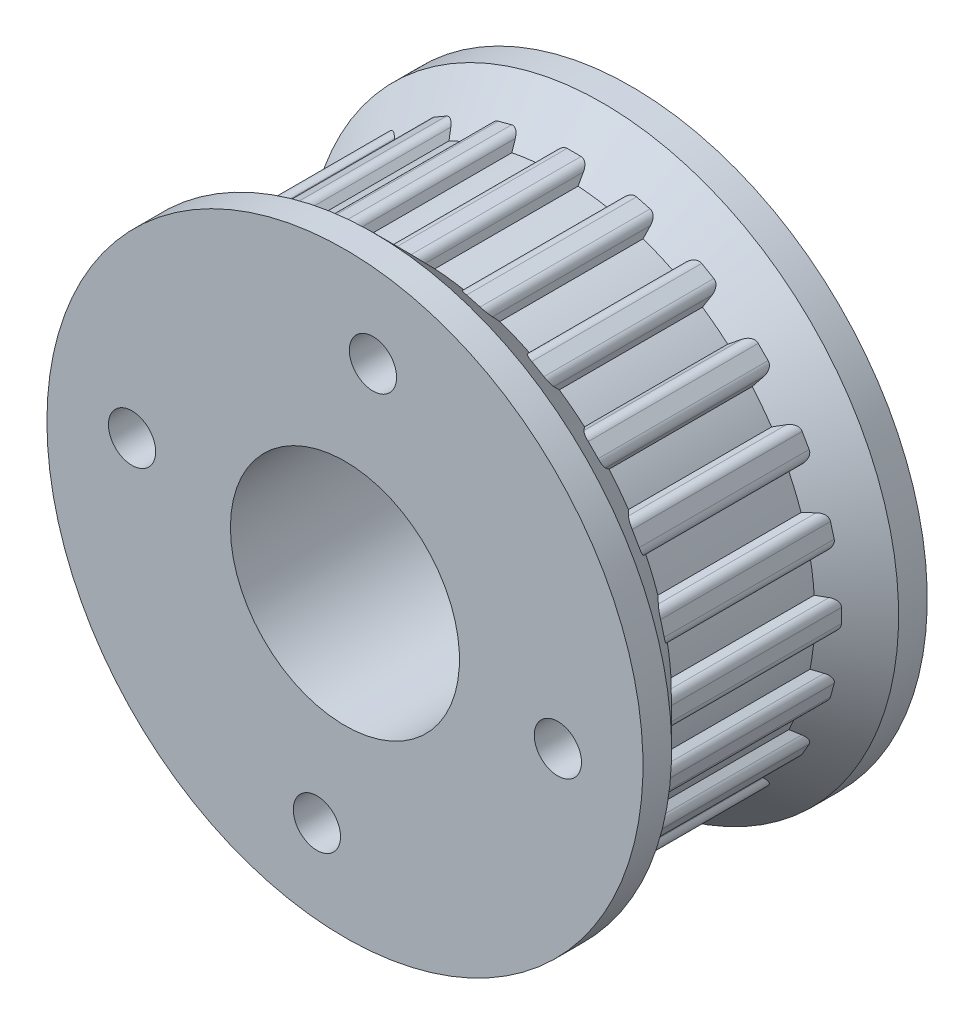
from build123d import *

# Parameters (mm, degrees)
ESQUISSE1_R             = 8
BOSS_EXTRU_1_DEPTH      = 19
ESQUISSE2_R             = 1.65
ENL_V_MAT_EXTRU_1_DEPTH = 36.592423812


with BuildPart() as part:
    # Esquisse1 → Boss.-Extru.1 (new body)
    with BuildSketch(Plane.XY):
        with BuildLine():
            Line((0.488939824, 18.675887158), (0, 18.675887158))
            Line((0, 18.675887158), (-0.488939824, 18.675887158))
            ThreePointArc((-0.488939824, 18.675887158), (-0.854196682, 18.551899162), (-1.06849532, 18.231178585))
            Line((-1.06849532, 18.231178585), (-1.352750131, 17.170325189))
            Line((-1.352750131, 17.170325189), (-3.137350881, 16.935378043))
            Line((-3.137350881, 16.935378043), (-3.686489007, 17.886513177))
            ThreePointArc((-3.686489007, 17.886513177), (-3.97649419, 18.140840897), (-4.361395677, 18.166068673))
            Line((-4.361395677, 18.166068673), (-4.833675281, 18.039521734))
            Line((-4.833675281, 18.039521734), (-5.305954884, 17.912974796))
            ThreePointArc((-5.305954884, 17.912974796), (-5.626675462, 17.698676158), (-5.750663457, 17.3334193))
            Line((-5.750663457, 17.3334193), (-5.750663457, 16.235143048))
            Line((-5.750663457, 16.235143048), (-7.413646616, 15.54631287))
            Line((-7.413646616, 15.54631287), (-8.190245201, 16.322911455))
            ThreePointArc((-8.190245201, 16.322911455), (-8.536193555, 16.493514304), (-8.91450927, 16.418262629))
            Line((-8.91450927, 16.418262629), (-9.337943579, 16.173792717))
            Line((-9.337943579, 16.173792717), (-9.761377888, 15.929322805))
            ThreePointArc((-9.761377888, 15.929322805), (-10.015705607, 15.639317622), (-10.040933383, 15.254416135))
            Line((-10.040933383, 15.254416135), (-9.756678573, 14.193562739))
            Line((-9.756678573, 14.193562739), (-11.184714585, 13.097792167))
            Line((-11.184714585, 13.097792167), (-12.13584972, 13.646930293))
            ThreePointArc((-12.13584972, 13.646930293), (-12.514165435, 13.722181967), (-12.860113788, 13.551579119))
            Line((-12.860113788, 13.551579119), (-13.205846454, 13.205846454))
            Line((-13.205846454, 13.205846454), (-13.551579119, 12.860113788))
            ThreePointArc((-13.551579119, 12.860113788), (-13.722181967, 12.514165435), (-13.646930293, 12.13584972))
            Line((-13.646930293, 12.13584972), (-13.097792167, 11.184714585))
            Line((-13.097792167, 11.184714585), (-14.193562739, 9.756678573))
            Line((-14.193562739, 9.756678573), (-15.254416135, 10.040933383))
            ThreePointArc((-15.254416135, 10.040933383), (-15.639317622, 10.015705607), (-15.929322805, 9.761377888))
            Line((-15.929322805, 9.761377888), (-16.173792717, 9.337943579))
            Line((-16.173792717, 9.337943579), (-16.418262629, 8.91450927))
            ThreePointArc((-16.418262629, 8.91450927), (-16.493514304, 8.536193555), (-16.322911455, 8.190245201))
            Line((-16.322911455, 8.190245201), (-15.54631287, 7.413646616))
            Line((-15.54631287, 7.413646616), (-16.235143048, 5.750663457))
            Line((-16.235143048, 5.750663457), (-17.3334193, 5.750663457))
            ThreePointArc((-17.3334193, 5.750663457), (-17.698676158, 5.626675462), (-17.912974796, 5.305954884))
            Line((-17.912974796, 5.305954884), (-18.039521734, 4.833675281))
            Line((-18.039521734, 4.833675281), (-18.166068673, 4.361395677))
            ThreePointArc((-18.166068673, 4.361395677), (-18.140840897, 3.97649419), (-17.886513177, 3.686489007))
            Line((-17.886513177, 3.686489007), (-16.935378043, 3.137350881))
            Line((-16.935378043, 3.137350881), (-17.170325189, 1.352750131))
            Line((-17.170325189, 1.352750131), (-18.231178585, 1.06849532))
            ThreePointArc((-18.231178585, 1.06849532), (-18.551899162, 0.854196682), (-18.675887158, 0.488939824))
            Line((-18.675887158, 0.488939824), (-18.675887158, 0))
            Line((-18.675887158, 0), (-18.675887158, -0.488939824))
            ThreePointArc((-18.675887158, -0.488939824), (-18.551899162, -0.854196682), (-18.231178585, -1.06849532))
            Line((-18.231178585, -1.06849532), (-17.170325189, -1.352750131))
            Line((-17.170325189, -1.352750131), (-16.935378043, -3.137350881))
            Line((-16.935378043, -3.137350881), (-17.886513177, -3.686489007))
            ThreePointArc((-17.886513177, -3.686489007), (-18.140840897, -3.97649419), (-18.166068673, -4.361395677))
            Line((-18.166068673, -4.361395677), (-18.039521734, -4.833675281))
            Line((-18.039521734, -4.833675281), (-17.912974796, -5.305954884))
            ThreePointArc((-17.912974796, -5.305954884), (-17.698676158, -5.626675462), (-17.3334193, -5.750663457))
            Line((-17.3334193, -5.750663457), (-16.235143048, -5.750663457))
            Line((-16.235143048, -5.750663457), (-15.54631287, -7.413646616))
            Line((-15.54631287, -7.413646616), (-16.322911455, -8.190245201))
            ThreePointArc((-16.322911455, -8.190245201), (-16.493514304, -8.536193555), (-16.418262629, -8.91450927))
            Line((-16.418262629, -8.91450927), (-16.173792717, -9.337943579))
            Line((-16.173792717, -9.337943579), (-15.929322805, -9.761377888))
            ThreePointArc((-15.929322805, -9.761377888), (-15.639317622, -10.015705607), (-15.254416135, -10.040933383))
            Line((-15.254416135, -10.040933383), (-14.193562739, -9.756678573))
            Line((-14.193562739, -9.756678573), (-13.097792167, -11.184714585))
            Line((-13.097792167, -11.184714585), (-13.646930293, -12.13584972))
            ThreePointArc((-13.646930293, -12.13584972), (-13.722181967, -12.514165435), (-13.551579119, -12.860113788))
            Line((-13.551579119, -12.860113788), (-13.205846454, -13.205846454))
            Line((-13.205846454, -13.205846454), (-12.860113788, -13.551579119))
            ThreePointArc((-12.860113788, -13.551579119), (-12.514165435, -13.722181967), (-12.13584972, -13.646930293))
            Line((-12.13584972, -13.646930293), (-11.184714585, -13.097792167))
            Line((-11.184714585, -13.097792167), (-9.756678573, -14.193562739))
            Line((-9.756678573, -14.193562739), (-10.040933383, -15.254416135))
            ThreePointArc((-10.040933383, -15.254416135), (-10.015705607, -15.639317622), (-9.761377888, -15.929322805))
            Line((-9.761377888, -15.929322805), (-9.337943579, -16.173792717))
            Line((-9.337943579, -16.173792717), (-8.91450927, -16.418262629))
            ThreePointArc((-8.91450927, -16.418262629), (-8.536193555, -16.493514304), (-8.190245201, -16.322911455))
            Line((-8.190245201, -16.322911455), (-7.413646616, -15.54631287))
            Line((-7.413646616, -15.54631287), (-5.750663457, -16.235143048))
            Line((-5.750663457, -16.235143048), (-5.750663457, -17.3334193))
            ThreePointArc((-5.750663457, -17.3334193), (-5.626675462, -17.698676158), (-5.305954884, -17.912974796))
            Line((-5.305954884, -17.912974796), (-4.833675281, -18.039521734))
            Line((-4.833675281, -18.039521734), (-4.361395677, -18.166068673))
            ThreePointArc((-4.361395677, -18.166068673), (-3.97649419, -18.140840897), (-3.686489007, -17.886513177))
            Line((-3.686489007, -17.886513177), (-3.137350881, -16.935378043))
            Line((-3.137350881, -16.935378043), (-1.352750131, -17.170325189))
            Line((-1.352750131, -17.170325189), (-1.06849532, -18.231178585))
            ThreePointArc((-1.06849532, -18.231178585), (-0.854196682, -18.551899162), (-0.488939824, -18.675887158))
            Line((-0.488939824, -18.675887158), (0, -18.675887158))
            Line((0, -18.675887158), (0.488939824, -18.675887158))
            ThreePointArc((0.488939824, -18.675887158), (0.854196682, -18.551899162), (1.06849532, -18.231178585))
            Line((1.06849532, -18.231178585), (1.352750131, -17.170325189))
            Line((1.352750131, -17.170325189), (3.137350881, -16.935378043))
            Line((3.137350881, -16.935378043), (3.686489007, -17.886513177))
            ThreePointArc((3.686489007, -17.886513177), (3.97649419, -18.140840897), (4.361395677, -18.166068673))
            Line((4.361395677, -18.166068673), (4.833675281, -18.039521734))
            Line((4.833675281, -18.039521734), (5.305954884, -17.912974796))
            ThreePointArc((5.305954884, -17.912974796), (5.626675462, -17.698676158), (5.750663457, -17.3334193))
            Line((5.750663457, -17.3334193), (5.750663457, -16.235143048))
            Line((5.750663457, -16.235143048), (7.413646616, -15.54631287))
            Line((7.413646616, -15.54631287), (8.190245201, -16.322911455))
            ThreePointArc((8.190245201, -16.322911455), (8.536193555, -16.493514304), (8.91450927, -16.418262629))
            Line((8.91450927, -16.418262629), (9.337943579, -16.173792717))
            Line((9.337943579, -16.173792717), (9.761377888, -15.929322805))
            ThreePointArc((9.761377888, -15.929322805), (10.015705607, -15.639317622), (10.040933383, -15.254416135))
            Line((10.040933383, -15.254416135), (9.756678573, -14.193562739))
            Line((9.756678573, -14.193562739), (11.184714585, -13.097792167))
            Line((11.184714585, -13.097792167), (12.13584972, -13.646930293))
            ThreePointArc((12.13584972, -13.646930293), (12.514165435, -13.722181967), (12.860113788, -13.551579119))
            Line((12.860113788, -13.551579119), (13.205846454, -13.205846454))
            Line((13.205846454, -13.205846454), (13.551579119, -12.860113788))
            ThreePointArc((13.551579119, -12.860113788), (13.722181967, -12.514165435), (13.646930293, -12.13584972))
            Line((13.646930293, -12.13584972), (13.097792167, -11.184714585))
            Line((13.097792167, -11.184714585), (14.193562739, -9.756678573))
            Line((14.193562739, -9.756678573), (15.254416135, -10.040933383))
            ThreePointArc((15.254416135, -10.040933383), (15.639317622, -10.015705607), (15.929322805, -9.761377888))
            Line((15.929322805, -9.761377888), (16.173792717, -9.337943579))
            Line((16.173792717, -9.337943579), (16.418262629, -8.91450927))
            ThreePointArc((16.418262629, -8.91450927), (16.493514304, -8.536193555), (16.322911455, -8.190245201))
            Line((16.322911455, -8.190245201), (15.54631287, -7.413646616))
            Line((15.54631287, -7.413646616), (16.235143048, -5.750663457))
            Line((16.235143048, -5.750663457), (17.3334193, -5.750663457))
            ThreePointArc((17.3334193, -5.750663457), (17.698676158, -5.626675462), (17.912974796, -5.305954884))
            Line((17.912974796, -5.305954884), (18.039521734, -4.833675281))
            Line((18.039521734, -4.833675281), (18.166068673, -4.361395677))
            ThreePointArc((18.166068673, -4.361395677), (18.140840897, -3.97649419), (17.886513177, -3.686489007))
            Line((17.886513177, -3.686489007), (16.935378043, -3.137350881))
            Line((16.935378043, -3.137350881), (17.170325189, -1.352750131))
            Line((17.170325189, -1.352750131), (18.231178585, -1.06849532))
            ThreePointArc((18.231178585, -1.06849532), (18.551899162, -0.854196682), (18.675887158, -0.488939824))
            Line((18.675887158, -0.488939824), (18.675887158, 0))
            Line((18.675887158, 0), (18.675887158, 0.488939824))
            ThreePointArc((18.675887158, 0.488939824), (18.551899162, 0.854196682), (18.231178585, 1.06849532))
            Line((18.231178585, 1.06849532), (17.170325189, 1.352750131))
            Line((17.170325189, 1.352750131), (16.935378043, 3.137350881))
            Line((16.935378043, 3.137350881), (17.886513177, 3.686489007))
            ThreePointArc((17.886513177, 3.686489007), (18.140840897, 3.97649419), (18.166068673, 4.361395677))
            Line((18.166068673, 4.361395677), (18.039521734, 4.833675281))
            Line((18.039521734, 4.833675281), (17.912974796, 5.305954884))
            ThreePointArc((17.912974796, 5.305954884), (17.698676158, 5.626675462), (17.3334193, 5.750663457))
            Line((17.3334193, 5.750663457), (16.235143048, 5.750663457))
            Line((16.235143048, 5.750663457), (15.54631287, 7.413646616))
            Line((15.54631287, 7.413646616), (16.322911455, 8.190245201))
            ThreePointArc((16.322911455, 8.190245201), (16.493514304, 8.536193555), (16.418262629, 8.91450927))
            Line((16.418262629, 8.91450927), (16.173792717, 9.337943579))
            Line((16.173792717, 9.337943579), (15.929322805, 9.761377888))
            ThreePointArc((15.929322805, 9.761377888), (15.639317622, 10.015705607), (15.254416135, 10.040933383))
            Line((15.254416135, 10.040933383), (14.193562739, 9.756678573))
            Line((14.193562739, 9.756678573), (13.097792167, 11.184714585))
            Line((13.097792167, 11.184714585), (13.646930293, 12.13584972))
            ThreePointArc((13.646930293, 12.13584972), (13.722181967, 12.514165435), (13.551579119, 12.860113788))
            Line((13.551579119, 12.860113788), (13.205846454, 13.205846454))
            Line((13.205846454, 13.205846454), (12.860113788, 13.551579119))
            ThreePointArc((12.860113788, 13.551579119), (12.514165435, 13.722181967), (12.13584972, 13.646930293))
            Line((12.13584972, 13.646930293), (11.184714585, 13.097792167))
            Line((11.184714585, 13.097792167), (9.756678573, 14.193562739))
            Line((9.756678573, 14.193562739), (10.040933383, 15.254416135))
            ThreePointArc((10.040933383, 15.254416135), (10.015705607, 15.639317622), (9.761377888, 15.929322805))
            Line((9.761377888, 15.929322805), (9.337943579, 16.173792717))
            Line((9.337943579, 16.173792717), (8.91450927, 16.418262629))
            ThreePointArc((8.91450927, 16.418262629), (8.536193555, 16.493514304), (8.190245201, 16.322911455))
            Line((8.190245201, 16.322911455), (7.413646616, 15.54631287))
            Line((7.413646616, 15.54631287), (5.750663457, 16.235143048))
            Line((5.750663457, 16.235143048), (5.750663457, 17.3334193))
            ThreePointArc((5.750663457, 17.3334193), (5.626675462, 17.698676158), (5.305954884, 17.912974796))
            Line((5.305954884, 17.912974796), (4.833675281, 18.039521734))
            Line((4.833675281, 18.039521734), (4.361395677, 18.166068673))
            ThreePointArc((4.361395677, 18.166068673), (3.97649419, 18.140840897), (3.686489007, 17.886513177))
            Line((3.686489007, 17.886513177), (3.137350881, 16.935378043))
            Line((3.137350881, 16.935378043), (1.352750131, 17.170325189))
            Line((1.352750131, 17.170325189), (1.06849532, 18.231178585))
            ThreePointArc((1.06849532, 18.231178585), (0.854196682, 18.551899162), (0.488939824, 18.675887158))
        make_face()
        Circle(ESQUISSE1_R, mode=Mode.SUBTRACT)
    extrude(amount=BOSS_EXTRU_1_DEPTH)

    # Esquisse3 → Révolution1 (revolve)
    with BuildSketch(Plane(origin=(0, 0, 0), x_dir=(1, 0, 0), z_dir=(0, 1, 0))):
        Polygon((-17.747198022, -4.5), (-17.747198022, -14.5), (-20.818508886, -17.571310864), (-20.818508886, -19.571310864), (-8, -19.571310864), (-8, 0.428689136), (-20.675887158, 0.428689136), (-20.675887158, -1.571310864), align=None)
    revolve(axis=Axis((0, 0, 0), (0, 0, 1)))

    # Esquisse2 → Enlèv. mat.-Extru.1 (cut, through all)
    with BuildSketch(Plane.XY.offset(-0.428689136)):
        with Locations((14.871672921, -1.957892883)):
            Circle(ESQUISSE2_R)
        with Locations((1.957892883, 14.871672921)):
            Circle(ESQUISSE2_R)
        with Locations((-1.957892883, -14.871672921)):
            Circle(ESQUISSE2_R)
        with Locations((-14.871672921, 1.957892883)):
            Circle(ESQUISSE2_R)
    extrude(amount=ENL_V_MAT_EXTRU_1_DEPTH, mode=Mode.SUBTRACT)


solid = part.part
